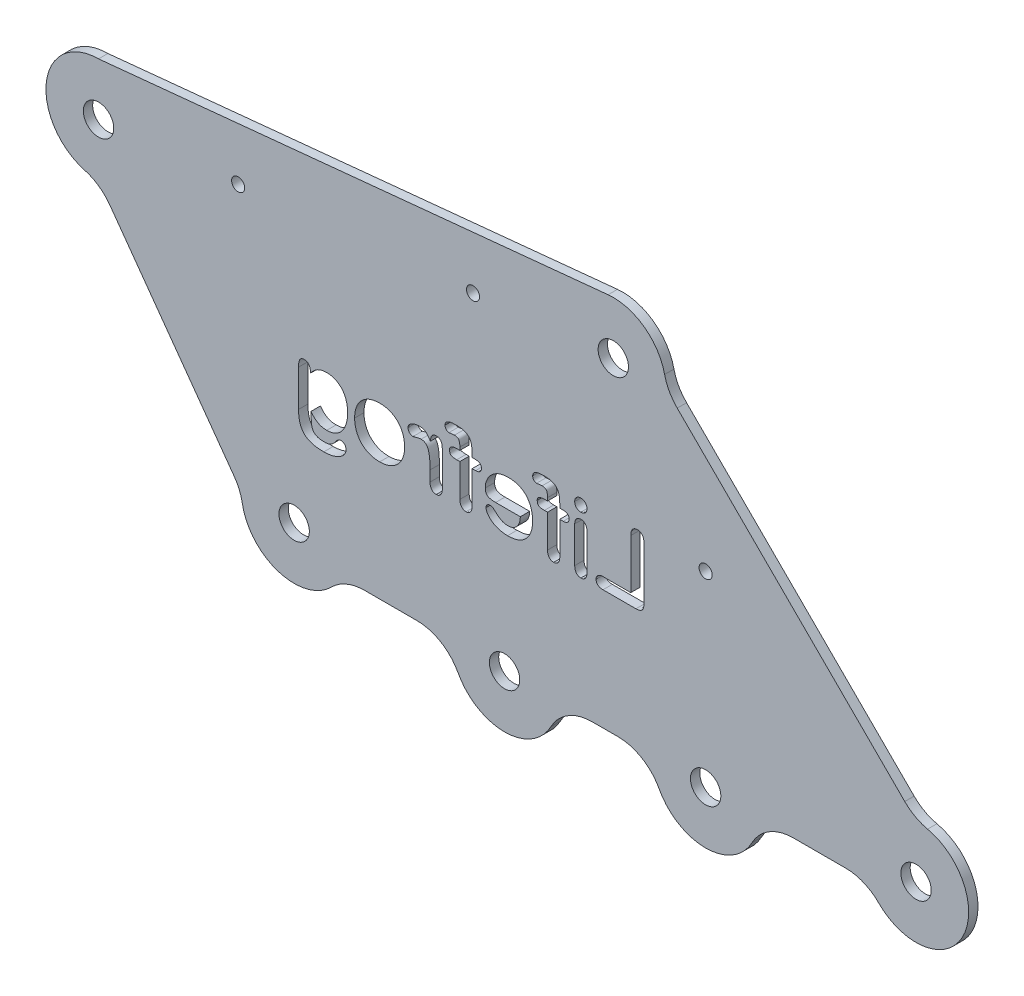
from build123d import *

# Parameters (mm, degrees)
SKETCH2_R           = 3.25
BOSS_EXTRUDE1_DEPTH = 2
SKETCH7_R           = 1.4
CUT_EXTRUDE4_DEPTH  = 171.622034838
CUT_EXTRUDE5_DEPTH  = 171.622034838
SKETCH9_R           = 4.424451358
SKETCH9_R_2         = 3.80051452
CUT_EXTRUDE6_DEPTH  = 10


with BuildPart() as part:
    # Sketch2 → Boss-Extrude1 (new body)
    with BuildSketch(Plane.XY):
        with BuildLine():
            Line((-146.482261324, -3.415116213), (-119.900209046, -40.345357838))
            ThreePointArc((-119.900209046, -40.345357838), (-118.800607084, -42.305283789), (-118.166440512, -44.46126778))
            ThreePointArc((-118.166440512, -44.46126778), (-110.464641635, -53.249940436), (-99.116582089, -50.460672154))
            ThreePointArc((-99.116582089, -50.460672154), (-95.868116105, -48.284014232), (-92.03329116, -47.519495684))
            Line((-92.03329116, -47.519495684), (-80.835284384, -47.519495684))
            ThreePointArc((-80.835284384, -47.519495684), (-75.69032683, -48.944566427), (-72.011754972, -52.813613331))
            ThreePointArc((-72.011754972, -52.813613331), (-62.085284384, -58.769495684), (-52.158813796, -52.813613331))
            ThreePointArc((-52.158813796, -52.813613331), (-48.480241938, -48.944566427), (-43.335284384, -47.519495684))
            Line((-43.335284384, -47.519495684), (-37.835284384, -47.519495684))
            ThreePointArc((-37.835284384, -47.519495684), (-32.69032683, -48.944566427), (-29.011754972, -52.813613331))
            ThreePointArc((-29.011754972, -52.813613331), (-19.085284384, -58.769495684), (-9.158813796, -52.813613331))
            ThreePointArc((-9.158813796, -52.813613331), (-5.480241938, -48.944566427), (-0.335284384, -47.519495684))
            Line((-0.335284384, -47.519495684), (10.862722393, -47.519495684))
            ThreePointArc((10.862722393, -47.519495684), (14.697547337, -48.284014232), (17.946013321, -50.460672154))
            ThreePointArc((17.946013321, -50.460672154), (35.766499874, -47.951332108), (28.376808321, -31.542219177))
            ThreePointArc((28.376808321, -31.542219177), (25.750662206, -30.549280626), (23.504036076, -28.865463113))
            Line((23.504036076, -28.865463113), (-25.162062888, 19.666448763))
            ThreePointArc((-25.162062888, 19.666448763), (-26.856748601, 21.916875345), (-27.856526133, 24.55066052))
            ThreePointArc((-27.856526133, 24.55066052), (-32.247109026, 31.201144138), (-39.941717654, 33.27458296))
            Line((-39.941717654, 33.27458296), (-148.918739614, 22.469864413))
            ThreePointArc((-148.918739614, 22.469864413), (-160.065949313, 12.737169894), (-151.925623591, 0.379147243))
            ThreePointArc((-151.925623591, 0.379147243), (-148.880072017, -1.053350399), (-146.482261324, -3.415116213))
        make_face()
        with Locations((25.914715616, -42.519495684)):
            Circle(SKETCH2_R, mode=Mode.SUBTRACT)
        with Locations((-19.085284384, -47.519495684)):
            Circle(SKETCH2_R, mode=Mode.SUBTRACT)
        with Locations((-62.085284384, -47.519495684)):
            Circle(SKETCH2_R, mode=Mode.SUBTRACT)
        with Locations((-107.085284384, -42.519495684)):
            Circle(SKETCH2_R, mode=Mode.SUBTRACT)
        with Locations((-148.918739614, 11.219864413)):
            Circle(SKETCH2_R, mode=Mode.SUBTRACT)
        with Locations((-38.831758764, 22.07947281)):
            Circle(SKETCH2_R, mode=Mode.SUBTRACT)
    extrude(amount=BOSS_EXTRUDE1_DEPTH)

    # Sketch7 → Cut-Extrude4 (cut, through all)
    with BuildSketch(Plane.XY.offset(2)):
        with Locations((-119.063647537, 14.164941171)):
            Circle(SKETCH7_R)
        with Locations((-68.831758764, 19.120101507)):
            Circle(SKETCH7_R)
        with Locations((-19.085284384, -7.519495684)):
            Circle(SKETCH7_R)
    extrude(amount=-CUT_EXTRUDE4_DEPTH, mode=Mode.SUBTRACT)

    # Sketch8 → Cut-Extrude5 (cut, through all)
    # profile 1 of 9: a face of its own
    with BuildSketch(Plane(origin=(0, 0, 0), x_dir=(-1, 0, 0), z_dir=(0, 0, -1))):
        with BuildLine():
            Line((35.086320726, -8.88917677), (35.086320726, -19.477067395))
            Line((35.086320726, -19.477067395), (41.039445726, -19.477067395))
            add(Edge.make_bspline(
                [(41.039445726, -19.477067395), (41.151207657, -19.479993195), (41.364330782, -19.485572515), (41.662298188, -19.554542719), (41.923339942, -19.661257744), (42.134401002, -19.819951832), (42.304522289, -20.005566477), (42.428077526, -20.217869304), (42.500347045, -20.454899643), (42.50877144, -20.620129964), (42.513078539, -20.704606457)],
                knots=[0, 0, 0, 0, 1.240270116, 2.365118784, 3.381765818, 4.352609133, 5.275186246, 6.165500839, 7.062084633, 8, 8, 8, 8], degree=3))
            add(Edge.make_bspline(
                [(42.513078539, -20.704606457), (42.508946769, -20.791061883), (42.500954328, -20.958300126), (42.427991131, -21.197153566), (42.305901504, -21.407864411), (42.137936653, -21.589554136), (41.927138947, -21.739731647), (41.667288952, -21.839448431), (41.367976859, -21.905877279), (41.153144472, -21.911559901), (41.039445726, -21.914567395)],
                knots=[0, 0, 0, 0, 0.961785517, 1.860465312, 2.752861249, 3.654173772, 4.599371787, 5.609990076, 6.735101654, 8, 8, 8, 8], degree=3))
            Line((41.039445726, -21.914567395), (33.996476976, -21.914567395))
            add(Edge.make_bspline(
                [(33.996476976, -21.914567395), (33.853353838, -21.910822677), (33.586803908, -21.903848583), (33.219164265, -21.820051925), (32.910084712, -21.691568649), (32.663815683, -21.496286799), (32.482305295, -21.2361672), (32.358100514, -20.915092293), (32.287886266, -20.530846545), (32.278723904, -20.25471837), (32.273820726, -20.106950207)],
                knots=[0, 0, 0, 0, 1.184943227, 2.206816713, 3.109923682, 3.939837529, 4.776053014, 5.71019795, 6.774627611, 8, 8, 8, 8], degree=3))
            Line((32.273820726, -20.106950207), (32.273820726, -8.88917677))
            add(Edge.make_bspline(
                [(32.273820726, -8.88917677), (32.277444522, -8.749162056), (32.284268854, -8.485486372), (32.356957437, -8.118037422), (32.476634418, -7.804802622), (32.645141816, -7.546892469), (32.856855173, -7.348035389), (33.099081612, -7.202614303), (33.373976884, -7.118889739), (33.566226734, -7.107793002), (33.665422289, -7.102067395)],
                knots=[0, 0, 0, 0, 1.312227502, 2.471186598, 3.495416453, 4.440711492, 5.33513045, 6.197779038, 7.0701043, 8, 8, 8, 8], degree=3))
            add(Edge.make_bspline(
                [(33.665422289, -7.102067395), (33.766728298, -7.106162598), (33.963485083, -7.114116312), (34.241681246, -7.204196573), (34.491196095, -7.34317393), (34.705487503, -7.541754535), (34.882515406, -7.795771782), (35.002902616, -8.111096688), (35.076257378, -8.481501141), (35.082815622, -8.747181708), (35.086320726, -8.88917677)],
                knots=[0, 0, 0, 0, 0.937651975, 1.821110013, 2.686129292, 3.571911612, 4.510265029, 5.535848738, 6.683015045, 8, 8, 8, 8], degree=3))
        make_face()
    # profile 2 of 9: a face of its own
    with BuildSketch(Plane(origin=(0, 0, 0), x_dir=(-1, 0, 0), z_dir=(0, 0, -1))):
        with BuildLine():
            Line((47.086320726, -12.74464552), (47.086320726, -20.476090832))
            add(Edge.make_bspline(
                [(47.086320726, -20.476090832), (47.082420593, -20.602435528), (47.075064066, -20.84074997), (47.005182236, -21.174236118), (46.88809835, -21.460321774), (46.722706311, -21.694972614), (46.519526295, -21.876468441), (46.28964053, -22.009165841), (46.031653529, -22.087195916), (45.85149376, -22.097028675), (45.759172289, -22.102067395)],
                knots=[0, 0, 0, 0, 1.279660949, 2.41372764, 3.434282009, 4.393028164, 5.297478756, 6.175532382, 7.06506577, 8, 8, 8, 8], degree=3))
            add(Edge.make_bspline(
                [(45.759172289, -22.102067395), (45.666704772, -22.097531408), (45.487838174, -22.08875712), (45.23365211, -22.004912745), (45.006451484, -21.871389965), (44.811013414, -21.682373157), (44.650959039, -21.445866625), (44.541087672, -21.160395096), (44.473171135, -20.832780478), (44.465421067, -20.599508451), (44.461320726, -20.476090832)],
                knots=[0, 0, 0, 0, 0.944656094, 1.82731652, 2.710883517, 3.62364324, 4.589202842, 5.612771424, 6.736985008, 8, 8, 8, 8], degree=3))
            Line((44.461320726, -20.476090832), (44.461320726, -12.823747082))
            add(Edge.make_bspline(
                [(44.461320726, -12.823747082), (44.4655151, -12.699382119), (44.473445887, -12.464230884), (44.539697696, -12.136087305), (44.650415089, -11.854229206), (44.811202223, -11.625466775), (45.007817757, -11.44586487), (45.234070933, -11.317596829), (45.488859368, -11.241954113), (45.666855774, -11.232151465), (45.759172289, -11.227067395)],
                knots=[0, 0, 0, 0, 1.282601348, 2.425162879, 3.437763456, 4.38569495, 5.284727511, 6.164859808, 7.048218153, 8, 8, 8, 8], degree=3))
            add(Edge.make_bspline(
                [(45.759172289, -11.227067395), (45.851434596, -11.232364163), (46.031201162, -11.242684541), (46.289294531, -11.316791228), (46.519597684, -11.446472242), (46.719799732, -11.624386887), (46.886864263, -11.846010703), (47.003355814, -12.112795725), (47.074726656, -12.416719887), (47.082335115, -12.631916842), (47.086320726, -12.74464552)],
                knots=[0, 0, 0, 0, 0.975882645, 1.901438153, 2.812865763, 3.75006033, 4.717368935, 5.725761173, 6.808663735, 8, 8, 8, 8], degree=3))
        make_face()
    # profile 3 of 9: a face of its own
    with BuildSketch(Plane(origin=(0, 0, 0), x_dir=(-1, 0, 0), z_dir=(0, 0, -1))):
        with BuildLine():
            add(Edge.make_bspline(
                [(45.788469164, -9.914567395), (45.700155278, -9.911112501), (45.527837589, -9.904371326), (45.279123369, -9.837014704), (45.05142568, -9.726888524), (44.844494731, -9.578448802), (44.672494362, -9.386651845), (44.546452039, -9.154497095), (44.472722475, -8.885778489), (44.46522284, -8.695310105), (44.461320726, -8.59620802)],
                knots=[0, 0, 0, 0, 1.006201835, 1.963296869, 2.915511555, 3.880878732, 4.85189213, 5.829536295, 6.870691953, 8, 8, 8, 8], degree=3))
            add(Edge.make_bspline(
                [(44.461320726, -8.59620802), (44.466503012, -8.504891338), (44.476546269, -8.327919822), (44.551669892, -8.073896193), (44.680826892, -7.848246813), (44.854448523, -7.652100465), (45.060826482, -7.494003153), (45.286053439, -7.371969471), (45.53257688, -7.303278473), (45.702130039, -7.29419357), (45.788469164, -7.289567395)],
                knots=[0, 0, 0, 0, 1.057408726, 2.04925565, 3.037480321, 4.047814229, 5.064214746, 6.036169889, 6.999986943, 8, 8, 8, 8], degree=3))
            add(Edge.make_bspline(
                [(45.788469164, -7.289567395), (45.871883282, -7.293289281), (46.035245133, -7.300578386), (46.272968232, -7.365176401), (46.494233713, -7.471719022), (46.696092474, -7.61868617), (46.874547315, -7.801949122), (46.996351464, -8.035133325), (47.076989401, -8.302838261), (47.083100242, -8.494958443), (47.086320726, -8.59620802)],
                knots=[0, 0, 0, 0, 0.967133894, 1.894077239, 2.837452275, 3.803721558, 4.782485793, 5.777084342, 6.828497526, 8, 8, 8, 8], degree=3))
            add(Edge.make_bspline(
                [(47.086320726, -8.59620802), (47.082548229, -8.694407685), (47.075299369, -8.883098506), (46.999769728, -9.148438196), (46.878868744, -9.381879948), (46.705206821, -9.571319036), (46.504492812, -9.722899361), (46.282136483, -9.833786351), (46.041845864, -9.904963009), (45.873933033, -9.911327839), (45.788469164, -9.914567395)],
                knots=[0, 0, 0, 0, 1.133982342, 2.178948973, 3.165031597, 4.149752721, 5.126395816, 6.06160272, 7.013399203, 8, 8, 8, 8], degree=3))
        make_face()
    # profile 4 of 9: a face of its own
    with BuildSketch(Plane(origin=(0, 0, 0), x_dir=(-1, 0, 0), z_dir=(0, 0, -1))):
        with BuildLine():
            Line((49.632219164, -11.414567395), (50.273820726, -11.414567395))
            Line((50.273820726, -11.414567395), (50.273820726, -10.591325207))
            add(Edge.make_bspline(
                [(50.273820726, -10.591325207), (50.277514056, -10.388045332), (50.284509589, -10.00301306), (50.342549558, -9.457909943), (50.436641901, -8.978381027), (50.569332837, -8.557808501), (50.755633772, -8.195572563), (50.996610195, -7.887535194), (51.293777818, -7.633608774), (51.648730133, -7.431434885), (52.067068931, -7.280410479), (52.552532894, -7.174729198), (53.108091552, -7.111487828), (53.502156344, -7.105323868), (53.710344164, -7.102067395)],
                knots=[0, 0, 0, 0, 1.272338929, 2.409936283, 3.426662608, 4.327577154, 5.161578725, 5.96266415, 6.760383261, 7.592994418, 8.506024445, 9.533847079, 10.697110196, 12, 12, 12, 12], degree=3))
            add(Edge.make_bspline(
                [(53.710344164, -7.102067395), (53.895146779, -7.104261268), (54.241413904, -7.108371958), (54.723647309, -7.168286024), (55.135762658, -7.255167266), (55.473032061, -7.391161667), (55.744889456, -7.558653085), (55.937764712, -7.776533401), (56.05427242, -8.037027657), (56.067659952, -8.223910447), (56.074601976, -8.320817395)],
                knots=[0, 0, 0, 0, 1.495564663, 2.802259462, 3.930374803, 4.895312065, 5.735498063, 6.492167842, 7.218122695, 8, 8, 8, 8], degree=3))
            add(Edge.make_bspline(
                [(56.074601976, -8.320817395), (56.07205453, -8.384563693), (56.067042815, -8.509974928), (56.019565864, -8.690669099), (55.937272087, -8.855101057), (55.831089458, -9.002344218), (55.703605103, -9.125761707), (55.560931421, -9.215318606), (55.405925119, -9.272564588), (55.297752865, -9.278650351), (55.242570726, -9.281754895)],
                knots=[0, 0, 0, 0, 1.08569999, 2.135951137, 3.156332465, 4.20565892, 5.218674748, 6.161348951, 7.062045096, 8, 8, 8, 8], degree=3))
            add(Edge.make_bspline(
                [(55.242570726, -9.281754895), (55.211291096, -9.281243662), (55.139763808, -9.280074624), (55.017892004, -9.265550853), (54.867145158, -9.249871502), (54.639618335, -9.213428957), (54.363834674, -9.175272517), (54.14601204, -9.167906783), (54.047258226, -9.164567395)],
                knots=[0, 0, 0, 0, 0.468218035, 1.070676523, 1.83620524, 2.737967929, 4.521099009, 6, 6, 6, 6], degree=3))
            add(Edge.make_bspline(
                [(54.047258226, -9.164567395), (53.935335203, -9.168513751), (53.730509601, -9.175735811), (53.453388449, -9.253609551), (53.236438618, -9.387787922), (53.093840565, -9.587280743), (53.00705741, -9.82836939), (52.94477266, -10.108223991), (52.902635068, -10.432859402), (52.900145328, -10.66441903), (52.898820726, -10.78761427)],
                knots=[0, 0, 0, 0, 1.158634456, 2.120368021, 2.955008234, 3.751380872, 4.611223429, 5.599229928, 6.722733105, 8, 8, 8, 8], degree=3))
            Line((52.898820726, -10.78761427), (52.898820726, -11.414567395))
            Line((52.898820726, -11.414567395), (53.563859789, -11.414567395))
            add(Edge.make_bspline(
                [(53.563859789, -11.414567395), (53.684179087, -11.416649074), (53.910242779, -11.420560268), (54.225792592, -11.467875581), (54.49621768, -11.540251074), (54.718209635, -11.648680399), (54.893566863, -11.789413733), (55.016660753, -11.965226471), (55.094330745, -12.172143548), (55.10125483, -12.32106946), (55.104875414, -12.398942395)],
                knots=[0, 0, 0, 0, 1.396050608, 2.622990337, 3.6962846, 4.634546857, 5.472373731, 6.277878481, 7.09950757, 8, 8, 8, 8], degree=3))
            add(Edge.make_bspline(
                [(55.104875414, -12.398942395), (55.100784732, -12.506003658), (55.0933337, -12.701011923), (55.017531846, -12.965095468), (54.888175636, -13.171513058), (54.692271136, -13.302589493), (54.461307669, -13.37783369), (54.196374468, -13.437731598), (53.892808985, -13.470942071), (53.677213775, -13.474956644), (53.563859789, -13.477067395)],
                knots=[0, 0, 0, 0, 1.171181197, 2.133264703, 2.982673099, 3.781862637, 4.659228062, 5.636037739, 6.757094158, 8, 8, 8, 8], degree=3))
            Line((53.563859789, -13.477067395), (52.898820726, -13.477067395))
            Line((52.898820726, -13.477067395), (52.898820726, -20.49073927))
            add(Edge.make_bspline(
                [(52.898820726, -20.49073927), (52.894890647, -20.614179922), (52.887425469, -20.848655192), (52.816934516, -21.176561155), (52.703366177, -21.461585314), (52.538062875, -21.695052259), (52.335369862, -21.875428653), (52.106713482, -22.010618694), (51.846897908, -22.086940159), (51.664920121, -22.096942211), (51.571672289, -22.102067395)],
                knots=[0, 0, 0, 0, 1.256538349, 2.386792053, 3.399650087, 4.363398215, 5.272567509, 6.146574889, 7.050280375, 8, 8, 8, 8], degree=3))
            add(Edge.make_bspline(
                [(51.571672289, -22.102067395), (51.482224977, -22.09710813), (51.307699782, -22.087431855), (51.057160741, -22.007724342), (50.831657988, -21.876461922), (50.631448396, -21.694722042), (50.469647741, -21.460721404), (50.355528177, -21.176665365), (50.285268804, -20.8486244), (50.277769023, -20.614169302), (50.273820726, -20.49073927)],
                knots=[0, 0, 0, 0, 0.920542794, 1.796117823, 2.680158831, 3.592296685, 4.561321835, 5.585807508, 6.729036556, 8, 8, 8, 8], degree=3))
            Line((50.273820726, -20.49073927), (50.273820726, -13.477067395))
            Line((50.273820726, -13.477067395), (49.532609789, -13.477067395))
            add(Edge.make_bspline(
                [(49.532609789, -13.477067395), (49.437497333, -13.474545828), (49.257144996, -13.469764431), (49.004612129, -13.411306638), (48.782055088, -13.326305771), (48.598641031, -13.197615767), (48.451306666, -13.041843238), (48.352045043, -12.858126156), (48.285842232, -12.656347119), (48.279207657, -12.513757181), (48.275773851, -12.43995802)],
                knots=[0, 0, 0, 0, 1.239726906, 2.350771435, 3.369360947, 4.331849643, 5.252604265, 6.143447782, 7.039118766, 8, 8, 8, 8], degree=3))
            add(Edge.make_bspline(
                [(48.275773851, -12.43995802), (48.278931014, -12.359364997), (48.28493967, -12.205981751), (48.351465421, -11.99217143), (48.459813646, -11.809230275), (48.613188222, -11.659732473), (48.810357544, -11.547566221), (49.047458479, -11.470404208), (49.325403123, -11.419710271), (49.525517403, -11.416355939), (49.632219164, -11.414567395)],
                knots=[0, 0, 0, 0, 0.995382564, 1.894394861, 2.740686784, 3.604514537, 4.515167111, 5.524921804, 6.68027808, 8, 8, 8, 8], degree=3))
        make_face()
    # profile 5 of 9: a face of its own
    with BuildSketch(Plane(origin=(0, 0, 0), x_dir=(-1, 0, 0), z_dir=(0, 0, -1))):
        with BuildLine():
            Line((63.993547289, -17.227067395), (58.711320726, -17.227067395))
            add(Edge.make_bspline(
                [(58.711320726, -17.227067395), (58.716485938, -17.373895282), (58.726607174, -17.661604604), (58.802714884, -18.07799563), (58.915860462, -18.469071713), (59.073647335, -18.829619398), (59.270554735, -19.153364248), (59.492765404, -19.442705533), (59.750507136, -19.684973297), (60.03645821, -19.88267243), (60.345770403, -20.033615445), (60.670482904, -20.148105778), (61.01253608, -20.212156224), (61.245255038, -20.222066531), (61.362687914, -20.227067395)],
                knots=[0, 0, 0, 0, 1.179639705, 2.311504614, 3.392005435, 4.44652888, 5.46432702, 6.431680492, 7.370191764, 8.295643874, 9.215452015, 10.129041871, 11.055891293, 12, 12, 12, 12], degree=3))
            add(Edge.make_bspline(
                [(61.362687914, -20.227067395), (61.517315025, -20.221290078), (61.81522082, -20.210159454), (62.248320892, -20.128402077), (62.65037596, -19.976572402), (63.029981243, -19.770423211), (63.382588562, -19.521193305), (63.667016112, -19.296133613), (63.89432751, -19.094787244), (64.085795058, -18.918875484), (64.304668367, -18.722900775), (64.455732274, -18.581855292), (64.535539476, -18.507340832)],
                knots=[0, 0, 0, 0, 1.247905556, 2.404224554, 3.538983975, 4.702801183, 5.881313568, 7.020008393, 7.628790321, 8.331868978, 9.11872483, 10, 10, 10, 10], degree=3))
            add(Edge.make_bspline(
                [(64.535539476, -18.507340832), (64.572653698, -18.48027204), (64.649909263, -18.423926662), (64.791469612, -18.369543996), (64.954050743, -18.338198915), (65.069560502, -18.333846809), (65.130266039, -18.331559582)],
                knots=[0, 0, 0, 0, 0.868866131, 1.808598965, 2.848320883, 4, 4, 4, 4], degree=3))
            add(Edge.make_bspline(
                [(65.130266039, -18.331559582), (65.197009882, -18.333900139), (65.324294385, -18.33836372), (65.504066974, -18.385198991), (65.666679189, -18.453914722), (65.804779268, -18.559309462), (65.921073021, -18.686697731), (66.001439392, -18.843467551), (66.053282091, -19.021621344), (66.057023071, -19.149522649), (66.058976976, -19.216325207)],
                knots=[0, 0, 0, 0, 1.102465736, 2.102468148, 3.057950005, 4.00546365, 4.956145095, 5.889200524, 6.897534264, 8, 8, 8, 8], degree=3))
            add(Edge.make_bspline(
                [(66.058976976, -19.216325207), (66.055140543, -19.281058441), (66.047007822, -19.418284177), (65.990684139, -19.630580971), (65.89753, -19.856403047), (65.771680317, -20.095129398), (65.612344825, -20.341196211), (65.409653802, -20.580823639), (65.174931597, -20.819411181), (64.902221637, -21.049528185), (64.595344086, -21.269822809), (64.249335099, -21.470546591), (63.864239991, -21.646257285), (63.446257949, -21.809324299), (62.992864569, -21.941257019), (62.504327356, -22.0333954), (61.984342492, -22.094193404), (61.625563625, -22.099400308), (61.441789476, -22.102067395)],
                knots=[0, 0, 0, 0, 0.525537938, 1.114069654, 1.772306998, 2.506549159, 3.302753817, 4.147512317, 5.050313588, 6.017967943, 7.041213872, 8.114344659, 9.260276936, 10.47524946, 11.755151616, 13.087980653, 14.508401902, 16, 16, 16, 16], degree=3))
            add(Edge.make_bspline(
                [(61.441789476, -22.102067395), (61.231648736, -22.097519737), (60.821964685, -22.088653761), (60.226784289, -22.021353682), (59.669210967, -21.908362258), (59.150569744, -21.745772772), (58.667513306, -21.542562166), (58.224053508, -21.288395048), (57.820679107, -20.987522623), (57.455460166, -20.64373407), (57.134442572, -20.257975864), (56.850340149, -19.841633038), (56.616330833, -19.388813691), (56.421842234, -18.905299727), (56.270116103, -18.389217889), (56.162139879, -17.840151988), (56.09676424, -17.258936562), (56.089857706, -16.86005426), (56.086320726, -16.655778332)],
                knots=[0, 0, 0, 0, 1.161895415, 2.265196273, 3.307380836, 4.303185105, 5.266158709, 6.199917451, 7.122316156, 8.043005893, 8.966794753, 9.89246016, 10.824859252, 11.779559524, 12.770652002, 13.794812853, 14.87067777, 16, 16, 16, 16], degree=3))
            add(Edge.make_bspline(
                [(56.086320726, -16.655778332), (56.089863596, -16.462226663), (56.096844531, -16.080848933), (56.163955879, -15.519624607), (56.268451373, -14.979723953), (56.413728423, -14.462108781), (56.604168314, -13.975533109), (56.829293377, -13.519340339), (57.098097208, -13.102077052), (57.402287332, -12.718106315), (57.750981266, -12.376213514), (58.140980683, -12.074737303), (58.573216423, -11.817183613), (59.045085371, -11.603132446), (59.551427203, -11.433045112), (60.089833345, -11.315293392), (60.656383848, -11.238702527), (61.044069017, -11.231007425), (61.242570726, -11.227067395)],
                knots=[0, 0, 0, 0, 1.095507523, 2.15860795, 3.195309999, 4.206995944, 5.197887526, 6.149926361, 7.082497361, 8.003040645, 8.917987058, 9.840388418, 10.787726911, 11.760164811, 12.769081724, 13.806049167, 14.876658106, 16, 16, 16, 16], degree=3))
            add(Edge.make_bspline(
                [(61.242570726, -11.227067395), (61.372538981, -11.22810589), (61.627045231, -11.23013949), (62.001408011, -11.265268194), (62.362503375, -11.313850777), (62.710727077, -11.382379075), (63.04253843, -11.478141357), (63.361054388, -11.589179566), (63.666118712, -11.720379466), (63.955121946, -11.874248291), (64.230989577, -12.038773815), (64.485024674, -12.223475089), (64.726773861, -12.411434191), (64.947774364, -12.616494045), (65.15303199, -12.831425773), (65.33677691, -13.06140635), (65.506460871, -13.299708893), (65.701149201, -13.632045496), (65.90499798, -14.058699678), (66.086744263, -14.582630241), (66.196585792, -15.115069491), (66.210329972, -15.472667779), (66.217180101, -15.65089552)],
                knots=[0, 0, 0, 0, 1.048847282, 2.053872234, 3.03283051, 3.989924751, 4.915857681, 5.818505585, 6.711913066, 7.593554535, 8.460263899, 9.302531452, 10.127499996, 10.930978608, 11.734070318, 12.524563272, 13.305443929, 14.093732096, 15.631266151, 17.114748765, 18.561984696, 20, 20, 20, 20], degree=3))
            add(Edge.make_bspline(
                [(66.217180101, -15.65089552), (66.215610952, -15.730068621), (66.212617901, -15.881086234), (66.186937014, -16.097314554), (66.140772023, -16.291180146), (66.075053252, -16.464024902), (65.995488051, -16.617172785), (65.89278487, -16.74579461), (65.773975455, -16.854326494), (65.582181996, -16.968584464), (65.300769745, -17.07492862), (64.916543956, -17.164445981), (64.474589043, -17.219117531), (64.159728488, -17.224321026), (63.993547289, -17.227067395)],
                knots=[0, 0, 0, 0, 0.899856074, 1.716417764, 2.470354694, 3.159019517, 3.814679391, 4.423252287, 5.02068589, 5.633798556, 6.949059873, 8.421953477, 10.111532063, 12, 12, 12, 12], degree=3))
        make_face()
        with BuildLine():
            Line((58.711320726, -15.727067395), (63.606828539, -15.727067395))
            add(Edge.make_bspline(
                [(63.606828539, -15.727067395), (63.597892017, -15.620388862), (63.580506578, -15.412852503), (63.525243597, -15.113999216), (63.460289426, -14.835108466), (63.374142884, -14.577543089), (63.272543011, -14.341165405), (63.154505162, -14.123236857), (63.017386306, -13.928050969), (62.863841728, -13.753386376), (62.694974951, -13.600302554), (62.514511391, -13.465060191), (62.318539721, -13.352382039), (62.109343802, -13.262997606), (61.88971522, -13.187447347), (61.65522259, -13.140138129), (61.409640164, -13.105158478), (61.240753138, -13.103110926), (61.154680101, -13.102067395)],
                knots=[0, 0, 0, 0, 1.274652096, 2.479755284, 3.617009281, 4.684005428, 5.71065458, 6.679155714, 7.63137599, 8.546404667, 9.444107911, 10.342338794, 11.228430864, 12.129821099, 13.049645363, 13.989847955, 14.975528821, 16, 16, 16, 16], degree=3))
            add(Edge.make_bspline(
                [(61.154680101, -13.102067395), (61.072577515, -13.10475237), (60.911762666, -13.110011447), (60.674960792, -13.138599654), (60.450175128, -13.191199261), (60.236485897, -13.265652746), (60.033877273, -13.359118289), (59.842432731, -13.474146939), (59.662756958, -13.609700616), (59.495375907, -13.766189336), (59.339368932, -13.941320054), (59.201880517, -14.138573533), (59.081832188, -14.355594311), (58.972348183, -14.589561112), (58.881951346, -14.845787112), (58.809840485, -15.122470817), (58.750931011, -15.417941176), (58.724734593, -15.622383021), (58.711320726, -15.727067395)],
                knots=[0, 0, 0, 0, 0.988988761, 1.937138454, 2.867098831, 3.763434994, 4.657917626, 5.549380048, 6.447873833, 7.363218941, 8.304708192, 9.267190604, 10.251834605, 11.288414524, 12.374576878, 13.518478699, 14.729337904, 16, 16, 16, 16], degree=3))
        make_face(mode=Mode.SUBTRACT)
    # profile 6 of 9: a face of its own
    with BuildSketch(Plane(origin=(0, 0, 0), x_dir=(-1, 0, 0), z_dir=(0, 0, -1))):
        with BuildLine():
            Line((68.382219164, -11.414567395), (69.023820726, -11.414567395))
            Line((69.023820726, -11.414567395), (69.023820726, -10.591325207))
            add(Edge.make_bspline(
                [(69.023820726, -10.591325207), (69.027514056, -10.388045332), (69.034509589, -10.00301306), (69.092549558, -9.457909943), (69.186641901, -8.978381027), (69.319332837, -8.557808501), (69.505633772, -8.195572563), (69.746610195, -7.887535194), (70.043777818, -7.633608774), (70.398730133, -7.431434885), (70.817068931, -7.280410479), (71.302532894, -7.174729198), (71.858091552, -7.111487828), (72.252156344, -7.105323868), (72.460344164, -7.102067395)],
                knots=[0, 0, 0, 0, 1.272338929, 2.409936283, 3.426662608, 4.327577154, 5.161578725, 5.96266415, 6.760383261, 7.592994418, 8.506024445, 9.533847079, 10.697110196, 12, 12, 12, 12], degree=3))
            add(Edge.make_bspline(
                [(72.460344164, -7.102067395), (72.645146779, -7.104261268), (72.991413904, -7.108371958), (73.473647309, -7.168286024), (73.885762658, -7.255167266), (74.223032061, -7.391161667), (74.494889456, -7.558653085), (74.687764712, -7.776533401), (74.80427242, -8.037027657), (74.817659952, -8.223910447), (74.824601976, -8.320817395)],
                knots=[0, 0, 0, 0, 1.495564663, 2.802259462, 3.930374803, 4.895312065, 5.735498063, 6.492167842, 7.218122695, 8, 8, 8, 8], degree=3))
            add(Edge.make_bspline(
                [(74.824601976, -8.320817395), (74.82205453, -8.384563693), (74.817042815, -8.509974928), (74.769565864, -8.690669099), (74.687272087, -8.855101057), (74.581089458, -9.002344218), (74.453605103, -9.125761707), (74.310931421, -9.215318606), (74.155925119, -9.272564588), (74.047752865, -9.278650351), (73.992570726, -9.281754895)],
                knots=[0, 0, 0, 0, 1.08569999, 2.135951137, 3.156332465, 4.20565892, 5.218674748, 6.161348951, 7.062045096, 8, 8, 8, 8], degree=3))
            add(Edge.make_bspline(
                [(73.992570726, -9.281754895), (73.961291096, -9.281243662), (73.889763808, -9.280074624), (73.767892004, -9.265550853), (73.617145158, -9.249871502), (73.389618335, -9.213428957), (73.113834674, -9.175272517), (72.89601204, -9.167906783), (72.797258226, -9.164567395)],
                knots=[0, 0, 0, 0, 0.468218035, 1.070676523, 1.83620524, 2.737967929, 4.521099009, 6, 6, 6, 6], degree=3))
            add(Edge.make_bspline(
                [(72.797258226, -9.164567395), (72.685335203, -9.168513751), (72.480509601, -9.175735811), (72.203388449, -9.253609551), (71.986438618, -9.387787922), (71.843840565, -9.587280743), (71.75705741, -9.82836939), (71.69477266, -10.108223991), (71.652635068, -10.432859402), (71.650145328, -10.66441903), (71.648820726, -10.78761427)],
                knots=[0, 0, 0, 0, 1.158634456, 2.120368021, 2.955008234, 3.751380872, 4.611223429, 5.599229928, 6.722733105, 8, 8, 8, 8], degree=3))
            Line((71.648820726, -10.78761427), (71.648820726, -11.414567395))
            Line((71.648820726, -11.414567395), (72.313859789, -11.414567395))
            add(Edge.make_bspline(
                [(72.313859789, -11.414567395), (72.434179087, -11.416649074), (72.660242779, -11.420560268), (72.975792592, -11.467875581), (73.24621768, -11.540251074), (73.468209635, -11.648680399), (73.643566863, -11.789413733), (73.766660753, -11.965226471), (73.844330745, -12.172143548), (73.85125483, -12.32106946), (73.854875414, -12.398942395)],
                knots=[0, 0, 0, 0, 1.396050608, 2.622990337, 3.6962846, 4.634546857, 5.472373731, 6.277878481, 7.09950757, 8, 8, 8, 8], degree=3))
            add(Edge.make_bspline(
                [(73.854875414, -12.398942395), (73.850784732, -12.506003658), (73.8433337, -12.701011923), (73.767531846, -12.965095468), (73.638175636, -13.171513058), (73.442271136, -13.302589493), (73.211307669, -13.37783369), (72.946374468, -13.437731598), (72.642808985, -13.470942071), (72.427213775, -13.474956644), (72.313859789, -13.477067395)],
                knots=[0, 0, 0, 0, 1.171181197, 2.133264703, 2.982673099, 3.781862637, 4.659228062, 5.636037739, 6.757094158, 8, 8, 8, 8], degree=3))
            Line((72.313859789, -13.477067395), (71.648820726, -13.477067395))
            Line((71.648820726, -13.477067395), (71.648820726, -20.49073927))
            add(Edge.make_bspline(
                [(71.648820726, -20.49073927), (71.644890647, -20.614179922), (71.637425469, -20.848655192), (71.566934516, -21.176561155), (71.453366177, -21.461585314), (71.288062875, -21.695052259), (71.085369862, -21.875428653), (70.856713482, -22.010618694), (70.596897908, -22.086940159), (70.414920121, -22.096942211), (70.321672289, -22.102067395)],
                knots=[0, 0, 0, 0, 1.256538349, 2.386792053, 3.399650087, 4.363398215, 5.272567509, 6.146574889, 7.050280375, 8, 8, 8, 8], degree=3))
            add(Edge.make_bspline(
                [(70.321672289, -22.102067395), (70.232224977, -22.09710813), (70.057699782, -22.087431855), (69.807160741, -22.007724342), (69.581657988, -21.876461922), (69.381448396, -21.694722042), (69.219647741, -21.460721404), (69.105528177, -21.176665365), (69.035268804, -20.8486244), (69.027769023, -20.614169302), (69.023820726, -20.49073927)],
                knots=[0, 0, 0, 0, 0.920542794, 1.796117823, 2.680158831, 3.592296685, 4.561321835, 5.585807508, 6.729036556, 8, 8, 8, 8], degree=3))
            Line((69.023820726, -20.49073927), (69.023820726, -13.477067395))
            Line((69.023820726, -13.477067395), (68.282609789, -13.477067395))
            add(Edge.make_bspline(
                [(68.282609789, -13.477067395), (68.187497333, -13.474545828), (68.007144996, -13.469764431), (67.754612129, -13.411306638), (67.532055088, -13.326305771), (67.348641031, -13.197615767), (67.201306666, -13.041843238), (67.102045043, -12.858126156), (67.035842232, -12.656347119), (67.029207657, -12.513757181), (67.025773851, -12.43995802)],
                knots=[0, 0, 0, 0, 1.239726906, 2.350771435, 3.369360947, 4.331849643, 5.252604265, 6.143447782, 7.039118766, 8, 8, 8, 8], degree=3))
            add(Edge.make_bspline(
                [(67.025773851, -12.43995802), (67.028931014, -12.359364997), (67.03493967, -12.205981751), (67.101465421, -11.99217143), (67.209813646, -11.809230275), (67.363188222, -11.659732473), (67.560357544, -11.547566221), (67.797458479, -11.470404208), (68.075403123, -11.419710271), (68.275517403, -11.416355939), (68.382219164, -11.414567395)],
                knots=[0, 0, 0, 0, 0.995382564, 1.894394861, 2.740686784, 3.604514537, 4.515167111, 5.524921804, 6.68027808, 8, 8, 8, 8], degree=3))
        make_face()
    # profile 7 of 9: a face of its own
    with BuildSketch(Plane(origin=(0, 0, 0), x_dir=(-1, 0, 0), z_dir=(0, 0, -1))):
        with BuildLine():
            Line((78.023820726, -18.21730177), (78.023820726, -20.464372082))
            add(Edge.make_bspline(
                [(78.023820726, -20.464372082), (78.019892411, -20.592663462), (78.012477123, -20.83483283), (77.942998305, -21.173173015), (77.826395379, -21.46268977), (77.660008013, -21.697626109), (77.457891862, -21.879946249), (77.226225762, -22.008518529), (76.969273636, -22.08740627), (76.789034454, -22.097099946), (76.696672289, -22.102067395)],
                knots=[0, 0, 0, 0, 1.292414504, 2.439627698, 3.46375878, 4.417332263, 5.316903122, 6.185375834, 7.070109971, 8, 8, 8, 8], degree=3))
            add(Edge.make_bspline(
                [(76.696672289, -22.102067395), (76.605316881, -22.09710505), (76.427986301, -22.087472609), (76.174585021, -22.009227395), (75.950610673, -21.875274697), (75.750230464, -21.695716107), (75.591715438, -21.458957778), (75.476710712, -21.174115576), (75.410996302, -20.840355995), (75.403041563, -20.602368539), (75.398820726, -20.476090832)],
                knots=[0, 0, 0, 0, 0.933294383, 1.81162385, 2.680186499, 3.585258456, 4.541104918, 5.566887721, 6.708974649, 8, 8, 8, 8], degree=3))
            Line((75.398820726, -20.476090832), (75.398820726, -13.028825207))
            add(Edge.make_bspline(
                [(75.398820726, -13.028825207), (75.402484719, -12.887967816), (75.409365917, -12.623429237), (75.466438734, -12.253599122), (75.562647251, -11.937580399), (75.705960969, -11.678454634), (75.886700953, -11.470839169), (76.115388002, -11.325648529), (76.384574397, -11.24325969), (76.575973652, -11.232631094), (76.676164476, -11.227067395)],
                knots=[0, 0, 0, 0, 1.34619872, 2.528241455, 3.567694465, 4.487339067, 5.340335725, 6.171799567, 7.043000931, 8, 8, 8, 8], degree=3))
            add(Edge.make_bspline(
                [(76.676164476, -11.227067395), (76.778250892, -11.23166171), (76.970074096, -11.240294554), (77.23647969, -11.31618665), (77.457457209, -11.448839438), (77.627712083, -11.63900255), (77.758010721, -11.876050227), (77.852605586, -12.159893812), (77.912208923, -12.492418163), (77.927694018, -12.729745798), (77.935930101, -12.855973645)],
                knots=[0, 0, 0, 0, 1.044883286, 1.963364657, 2.807970932, 3.650974255, 4.547373518, 5.563477854, 6.704082887, 8, 8, 8, 8], degree=3))
            add(Edge.make_bspline(
                [(77.935930101, -12.855973645), (78.015060213, -12.728702257), (78.166410553, -12.485273209), (78.414258837, -12.155879517), (78.661252631, -11.872664951), (78.918064986, -11.635812705), (79.199992654, -11.445181426), (79.525823034, -11.317799074), (79.892305657, -11.240889927), (80.150364302, -11.231818927), (80.285539476, -11.227067395)],
                knots=[0, 0, 0, 0, 1.18924255, 2.274636787, 3.268721947, 4.168850259, 5.041860026, 5.953170485, 6.927838526, 8, 8, 8, 8], degree=3))
            add(Edge.make_bspline(
                [(80.285539476, -11.227067395), (80.426467245, -11.232489358), (80.70936151, -11.243373249), (81.129162593, -11.320929872), (81.541294315, -11.453132582), (81.873448057, -11.600397905), (82.12154417, -11.742608322), (82.286513298, -11.857020394), (82.423463313, -11.98382965), (82.540429583, -12.115426572), (82.630091374, -12.257833616), (82.691453181, -12.409798496), (82.732078243, -12.569674136), (82.735800435, -12.679941298), (82.737687914, -12.735856457)],
                knots=[0, 0, 0, 0, 1.609451603, 3.230765888, 4.857137694, 6.544750347, 7.369389467, 8.121503283, 8.832102741, 9.496362917, 10.127778221, 10.743023735, 11.362602371, 12, 12, 12, 12], degree=3))
            add(Edge.make_bspline(
                [(82.737687914, -12.735856457), (82.734447601, -12.813574254), (82.728170407, -12.9641306), (82.658798765, -13.177988977), (82.553564502, -13.372817877), (82.402963372, -13.536083886), (82.232143043, -13.670264449), (82.04869511, -13.768279515), (81.85786951, -13.830801857), (81.727395914, -13.839133704), (81.662492601, -13.843278332)],
                knots=[0, 0, 0, 0, 1.088483127, 2.10862957, 3.128406662, 4.178128692, 5.204900727, 6.16884502, 7.089102868, 8, 8, 8, 8], degree=3))
            add(Edge.make_bspline(
                [(81.662492601, -13.843278332), (81.629178627, -13.840040056), (81.542984296, -13.831661558), (81.39025665, -13.792022204), (81.183740219, -13.737267753), (80.939095726, -13.659990651), (80.677274642, -13.576472525), (80.415801332, -13.523477689), (80.172440405, -13.484406004), (80.015169718, -13.479444147), (79.939836351, -13.477067395)],
                knots=[0, 0, 0, 0, 0.454029574, 1.174725489, 2.136679894, 3.357464208, 4.658256254, 5.865202561, 6.977422421, 8, 8, 8, 8], degree=3))
            add(Edge.make_bspline(
                [(79.939836351, -13.477067395), (79.845889074, -13.48141761), (79.66407233, -13.489836608), (79.402436427, -13.542788927), (79.170931902, -13.646030446), (78.963806071, -13.78176069), (78.785197235, -13.961357491), (78.627437355, -14.175620461), (78.492532222, -14.42885195), (78.379665037, -14.716376161), (78.288170049, -15.037011302), (78.209419115, -15.386257938), (78.144574547, -15.764579045), (78.099652318, -16.17561647), (78.064172897, -16.623081436), (78.042345893, -17.113612554), (78.02739976, -17.649826852), (78.025046467, -18.022954037), (78.023820726, -18.21730177)],
                knots=[0, 0, 0, 0, 0.794050632, 1.536731085, 2.238662641, 2.922771156, 3.616952249, 4.366019506, 5.163320251, 6.033432924, 6.970572952, 7.977209821, 9.05675488, 10.211001348, 11.468820729, 12.84806026, 14.358274693, 16, 16, 16, 16], degree=3))
        make_face()
    # profile 8 of 9: a face of its own
    with BuildSketch(Plane(origin=(0, 0, 0), x_dir=(-1, 0, 0), z_dir=(0, 0, -1))):
        with BuildLine():
            add(Edge.make_bspline(
                [(94.148820726, -16.67042677), (94.144486428, -16.865958198), (94.135962174, -17.250509443), (94.063694953, -17.815248603), (93.947256433, -18.356735194), (93.783210596, -18.872727585), (93.575555832, -19.359535852), (93.326640268, -19.813005753), (93.033540056, -20.230278447), (92.700172687, -20.609939276), (92.32896808, -20.9531364), (91.919659255, -21.251299839), (91.478131715, -21.51184656), (91.000994931, -21.724708392), (90.492501837, -21.896725611), (89.950942693, -22.014013606), (89.380489134, -22.090278252), (88.989896722, -22.098082029), (88.790422289, -22.102067395)],
                knots=[0, 0, 0, 0, 1.091425222, 2.14650367, 3.173246554, 4.180341516, 5.164818684, 6.123963105, 7.063390915, 8.006199165, 8.940071845, 9.880179878, 10.828459563, 11.797350195, 12.792281962, 13.820196984, 14.886780802, 16, 16, 16, 16], degree=3))
            add(Edge.make_bspline(
                [(88.790422289, -22.102067395), (88.591870928, -22.098480665), (88.203960118, -22.091473252), (87.638922615, -22.010038917), (87.101578123, -21.894122427), (86.597818959, -21.719498742), (86.124926323, -21.501305834), (85.684600318, -21.240748892), (85.277774178, -20.936460383), (84.904876516, -20.593622978), (84.569894039, -20.211571465), (84.277056806, -19.794745386), (84.02509942, -19.345794671), (83.821438064, -18.863747925), (83.658781072, -18.352053245), (83.547410974, -17.811904116), (83.473790099, -17.246665517), (83.465530656, -16.861096277), (83.461320726, -16.664567395)],
                knots=[0, 0, 0, 0, 1.111227023, 2.171009928, 3.19145726, 4.186070048, 5.150303806, 6.104321695, 7.046220171, 7.990735544, 8.936485474, 9.886464991, 10.839039205, 11.814379169, 12.812535149, 13.84133354, 14.899703965, 16, 16, 16, 16], degree=3))
            add(Edge.make_bspline(
                [(83.461320726, -16.664567395), (83.465514225, -16.466082785), (83.473742721, -16.076615619), (83.547624747, -15.505610155), (83.658102464, -14.959085186), (83.824393346, -14.441866346), (84.031384338, -13.954809255), (84.28098393, -13.502415749), (84.569020413, -13.085777538), (84.899270526, -12.708353762), (85.269523718, -12.371342104), (85.67658854, -12.072840001), (86.121373859, -11.818014706), (86.60023799, -11.604092229), (87.110125782, -11.43336561), (87.648459537, -11.31556227), (88.211067148, -11.238923762), (88.594851206, -11.231069711), (88.790422289, -11.227067395)],
                knots=[0, 0, 0, 0, 1.109458584, 2.176983352, 3.214831729, 4.223461232, 5.209438476, 6.170044374, 7.10777617, 8.036608407, 8.968213882, 9.902121437, 10.853822319, 11.829170779, 12.830797886, 13.854949514, 14.906911741, 16, 16, 16, 16], degree=3))
            add(Edge.make_bspline(
                [(88.790422289, -11.227067395), (88.988898872, -11.231174927), (89.378472694, -11.239237275), (89.948439143, -11.31420497), (90.490442677, -11.436140384), (91.001366108, -11.60975716), (91.480472692, -11.827861391), (91.928322675, -12.083355331), (92.33525077, -12.389972109), (92.707032955, -12.732556775), (93.044393285, -13.110969179), (93.333369182, -13.530134072), (93.585085083, -13.980402785), (93.789040515, -14.465390299), (93.949727682, -14.979606196), (94.06772993, -15.519473979), (94.135154052, -16.08667861), (94.144198204, -16.472983807), (94.148820726, -16.67042677)],
                knots=[0, 0, 0, 0, 1.106546112, 2.171950929, 3.199928065, 4.200661522, 5.175688508, 6.132331741, 7.070262582, 8.010799296, 8.948477062, 9.891329305, 10.844648531, 11.82089183, 12.82003801, 13.845645933, 14.898896381, 16, 16, 16, 16], degree=3))
        make_face()
        with BuildLine():
            add(Edge.make_bspline(
                [(91.523820726, -16.67042677), (91.52166415, -16.540471396), (91.517472317, -16.287871443), (91.48242374, -15.920543914), (91.422249062, -15.575532262), (91.347241139, -15.250399141), (91.238347477, -14.950063385), (91.115116448, -14.668872274), (90.959772356, -14.413974861), (90.788871248, -14.178150822), (90.594058889, -13.971012519), (90.386177552, -13.786309146), (90.158198426, -13.634549), (89.916762502, -13.505920097), (89.656972659, -13.41067581), (89.382530068, -13.338976081), (89.091429338, -13.298458846), (88.892104067, -13.292570974), (88.790422289, -13.289567395)],
                knots=[0, 0, 0, 0, 1.270558422, 2.469640054, 3.603049319, 4.693866399, 5.726721989, 6.722451407, 7.690273023, 8.639449843, 9.565088081, 10.465156222, 11.352368502, 12.23649231, 13.133922735, 14.051050542, 15.005782631, 16, 16, 16, 16], degree=3))
            add(Edge.make_bspline(
                [(88.790422289, -13.289567395), (88.659103624, -13.293167537), (88.402886757, -13.300191802), (88.031896286, -13.381687907), (87.682368849, -13.501977975), (87.361299048, -13.680841795), (87.069660153, -13.904384313), (86.809174008, -14.175320472), (86.591638168, -14.498289914), (86.405589523, -14.862686984), (86.265324847, -15.26874037), (86.158586264, -15.706832305), (86.097485862, -16.178473495), (86.090114639, -16.503261048), (86.086320726, -16.67042677)],
                knots=[0, 0, 0, 0, 0.966943267, 1.886610523, 2.788820013, 3.685057501, 4.584069546, 5.490925344, 6.443978365, 7.44584051, 8.500680597, 9.604835001, 10.767226511, 12, 12, 12, 12], degree=3))
            add(Edge.make_bspline(
                [(86.086320726, -16.67042677), (86.089975868, -16.835677251), (86.09707534, -17.156647376), (86.160125836, -17.622697678), (86.260583866, -18.057364566), (86.404461982, -18.457425943), (86.584101967, -18.819204405), (86.804143131, -19.136915148), (87.056381643, -19.412930615), (87.347066752, -19.640114593), (87.667609463, -19.820805111), (88.018399206, -19.946385134), (88.395336031, -20.025112761), (88.656230869, -20.034657865), (88.790422289, -20.039567395)],
                knots=[0, 0, 0, 0, 1.221452891, 2.372458373, 3.470695752, 4.514597835, 5.509283355, 6.448751658, 7.363470559, 8.263476682, 9.165479573, 10.07241203, 11.008543944, 12, 12, 12, 12], degree=3))
            add(Edge.make_bspline(
                [(88.790422289, -20.039567395), (88.892104988, -20.036565161), (89.091432064, -20.030679926), (89.382519836, -19.990143766), (89.657009064, -19.918512142), (89.916630477, -19.823021901), (90.159172029, -19.695037632), (90.385237239, -19.539497593), (90.594238165, -19.355423123), (90.788693162, -19.147917518), (90.960812629, -18.911868837), (91.113426664, -18.65546104), (91.239281777, -18.375603349), (91.346578942, -18.076574149), (91.422386771, -17.753673501), (91.482396805, -17.41152253), (91.517390152, -17.048105533), (91.521641272, -16.798429867), (91.523820726, -16.67042677)],
                knots=[0, 0, 0, 0, 0.996858043, 1.954125933, 2.873689662, 3.773503692, 4.659975762, 5.554937906, 6.457396659, 7.385493423, 8.337191288, 9.315813857, 10.305473609, 11.341072498, 12.425486328, 13.552469893, 14.745206377, 16, 16, 16, 16], degree=3))
        make_face(mode=Mode.SUBTRACT)
    # profile 9 of 9: a face of its own
    with BuildSketch(Plane(origin=(0, 0, 0), x_dir=(-1, 0, 0), z_dir=(0, 0, -1))):
        with BuildLine():
            Line((106.148820726, -13.24855177), (106.148820726, -21.073747082))
            add(Edge.make_bspline(
                [(106.148820726, -21.073747082), (106.145578638, -21.289668532), (106.139304115, -21.707548589), (106.087647215, -22.310838809), (105.997312618, -22.867172203), (105.87222542, -23.377416774), (105.710318638, -23.84506679), (105.498897586, -24.267423187), (105.251306447, -24.653258133), (104.95074422, -24.991966607), (104.608489437, -25.293090564), (104.21162859, -25.544239225), (103.771825619, -25.762432035), (103.278649661, -25.935378901), (102.731346807, -26.064718882), (102.126361775, -26.161485854), (101.458368356, -26.21486082), (100.99266219, -26.222879134), (100.749406664, -26.227067395)],
                knots=[0, 0, 0, 0, 1.193077057, 2.309002223, 3.342578962, 4.304588778, 5.20921544, 6.070806415, 6.909010715, 7.734982653, 8.56501699, 9.419735828, 10.32236431, 11.273091887, 12.300564439, 13.426427611, 14.655728113, 16, 16, 16, 16], degree=3))
            add(Edge.make_bspline(
                [(100.749406664, -26.227067395), (100.523599423, -26.22202945), (100.082375219, -26.212185377), (99.439313286, -26.134772632), (98.833121089, -26.009911299), (98.268330391, -25.836151213), (97.756709712, -25.61584198), (97.297156849, -25.373194016), (96.90504392, -25.092286158), (96.573717183, -24.789883295), (96.315558172, -24.464949316), (96.126441952, -24.133851937), (96.006001323, -23.795706697), (95.990460317, -23.565867789), (95.982805101, -23.452653332)],
                knots=[0, 0, 0, 0, 1.351069114, 2.639970243, 3.869855339, 5.051064834, 6.169170093, 7.199517556, 8.154742545, 9.047991741, 9.875849639, 10.626865665, 11.323619059, 12, 12, 12, 12], degree=3))
            add(Edge.make_bspline(
                [(95.982805101, -23.452653332), (95.986362338, -23.370162444), (95.993247098, -23.210507621), (96.057116047, -22.984868315), (96.157368182, -22.781008156), (96.303861587, -22.611745282), (96.470588202, -22.464836911), (96.665111076, -22.367013987), (96.872932257, -22.299769261), (97.018377877, -22.293031512), (97.093156664, -22.289567395)],
                knots=[0, 0, 0, 0, 1.100593589, 2.130114972, 3.111132825, 4.112532503, 5.103922639, 6.06172617, 7.003464206, 8, 8, 8, 8], degree=3))
            add(Edge.make_bspline(
                [(97.093156664, -22.289567395), (97.187212984, -22.297807486), (97.378139595, -22.314534196), (97.648882696, -22.444243677), (97.896424463, -22.652776613), (98.029590187, -22.834019726), (98.100969164, -22.931168957)],
                knots=[0, 0, 0, 0, 0.904802776, 1.836675377, 2.840423108, 4, 4, 4, 4], degree=3))
            add(Edge.make_bspline(
                [(98.100969164, -22.931168957), (98.175137825, -23.022999385), (98.32511679, -23.208692807), (98.550660272, -23.486189079), (98.794314447, -23.746512382), (99.069278385, -23.974281206), (99.395284902, -24.146027838), (99.772091926, -24.269467496), (100.206663136, -24.341146724), (100.515728119, -24.348291041), (100.679094164, -24.352067395)],
                knots=[0, 0, 0, 0, 0.914657093, 1.849559125, 2.770081465, 3.674097889, 4.601683639, 5.60665287, 6.734920882, 8, 8, 8, 8], degree=3))
            add(Edge.make_bspline(
                [(100.679094164, -24.352067395), (100.845352039, -24.349772775), (101.160483048, -24.345423472), (101.601600038, -24.285053864), (101.987484027, -24.198980643), (102.315356429, -24.065654609), (102.590780708, -23.897104225), (102.822544745, -23.700428003), (103.009718901, -23.473887214), (103.146973543, -23.215432589), (103.2490308, -22.942063458), (103.329376819, -22.657754766), (103.384375905, -22.364576568), (103.411886425, -22.110415408), (103.420846671, -21.891048453), (103.434474931, -21.702786676), (103.442908283, -21.489822304), (103.446736788, -21.254357994), (103.457934273, -20.995690136), (103.462185369, -20.713390218), (103.46845611, -20.407737957), (103.47212331, -20.195818841), (103.474016039, -20.086442395)],
                knots=[0, 0, 0, 0, 1.649040383, 3.12564899, 4.411803224, 5.563945921, 6.621369587, 7.604506927, 8.568970364, 9.519051572, 10.494848921, 11.461599492, 12.448362545, 13.452543324, 13.996197049, 14.627512153, 15.326100287, 16.111569937, 16.965155253, 17.896000539, 18.914076333, 20, 20, 20, 20], degree=3))
            add(Edge.make_bspline(
                [(103.474016039, -20.086442395), (103.369286653, -20.228243024), (103.164348005, -20.505724162), (102.817528696, -20.877376), (102.442844477, -21.192720198), (102.044348908, -21.45735916), (101.614316585, -21.66752994), (101.144288907, -21.808776911), (100.637665064, -21.899353304), (100.285949179, -21.909396738), (100.104875414, -21.914567395)],
                knots=[0, 0, 0, 0, 1.055738715, 2.065911711, 3.03769406, 3.983909981, 4.926118454, 5.894140725, 6.915841209, 8, 8, 8, 8], degree=3))
            add(Edge.make_bspline(
                [(100.104875414, -21.914567395), (99.994441226, -21.912166001), (99.776036181, -21.90741678), (99.454056448, -21.874236458), (99.141308415, -21.822584081), (98.840065478, -21.745500132), (98.548288958, -21.6498829), (98.269175954, -21.527797069), (97.999295761, -21.38790609), (97.740990466, -21.225864527), (97.49518965, -21.04571704), (97.267047943, -20.843687043), (97.047384126, -20.630613496), (96.847523825, -20.395110591), (96.656759723, -20.146190033), (96.489652732, -19.874613587), (96.329534366, -19.590507719), (96.137445139, -19.184568503), (95.938137553, -18.639859379), (95.768966666, -17.942277255), (95.669099205, -17.195772906), (95.655707561, -16.682454565), (95.648820726, -16.418473645)],
                knots=[0, 0, 0, 0, 0.833112071, 1.647640849, 2.439835632, 3.222550966, 3.991445903, 4.753817451, 5.518393315, 6.283004681, 7.052252564, 7.814695319, 8.580583639, 9.358986843, 10.142949644, 10.944274693, 11.762261925, 12.602672888, 14.330023006, 16.127783965, 18.00866038, 20, 20, 20, 20], degree=3))
            add(Edge.make_bspline(
                [(95.648820726, -16.418473645), (95.652642272, -16.221051999), (95.660134445, -15.834005236), (95.722041146, -15.269528036), (95.82493923, -14.734584178), (95.966260416, -14.230525635), (96.152476688, -13.76221528), (96.367793789, -13.327108628), (96.624535766, -12.933618383), (96.912501305, -12.577509314), (97.229367893, -12.259884554), (97.572416193, -11.984063386), (97.938958298, -11.750329511), (98.328110609, -11.559102539), (98.73859142, -11.409212488), (99.170060443, -11.304717183), (99.62033266, -11.237447396), (99.927871945, -11.230568047), (100.084367601, -11.227067395)],
                knots=[0, 0, 0, 0, 1.233131348, 2.417564159, 3.54229185, 4.633406881, 5.682503965, 6.686568855, 7.661289661, 8.611256522, 9.54308529, 10.458735841, 11.355741272, 12.253410383, 13.162451714, 14.079868853, 15.022914474, 16, 16, 16, 16], degree=3))
            add(Edge.make_bspline(
                [(100.084367601, -11.227067395), (100.269315783, -11.232430291), (100.627605237, -11.242819521), (101.14571427, -11.330564927), (101.62709314, -11.467956721), (102.071592609, -11.673662781), (102.49184011, -11.934169427), (102.886423171, -12.266181645), (103.275177029, -12.652319523), (103.504732301, -12.950707472), (103.623430101, -13.104997082)],
                knots=[0, 0, 0, 0, 1.061471399, 2.056327376, 3.009310916, 3.92787468, 4.860034948, 5.84023928, 6.88323694, 8, 8, 8, 8], degree=3))
            Line((103.623430101, -13.104997082), (103.623430101, -12.727067395))
            add(Edge.make_bspline(
                [(103.623430101, -12.727067395), (103.626077546, -12.612313503), (103.631086744, -12.39518899), (103.702722773, -12.091704756), (103.804214345, -11.823343153), (103.960484058, -11.603122273), (104.14437401, -11.422724439), (104.362000974, -11.298828456), (104.601104557, -11.2172405), (104.770200341, -11.210177814), (104.856828539, -11.206559582)],
                knots=[0, 0, 0, 0, 1.247113373, 2.359648813, 3.381150232, 4.352198038, 5.277883478, 6.164782314, 7.059813345, 8, 8, 8, 8], degree=3))
            add(Edge.make_bspline(
                [(104.856828539, -11.206559582), (104.919398777, -11.208373393), (105.039147367, -11.211844711), (105.210376067, -11.234486995), (105.36533458, -11.275276426), (105.503505909, -11.334986164), (105.628592504, -11.406301328), (105.733159003, -11.500628587), (105.821383334, -11.609854306), (105.921728419, -11.781388496), (106.018246955, -12.037350669), (106.092298497, -12.391051336), (106.143763737, -12.800784613), (106.147065006, -13.093092856), (106.148820726, -13.24855177)],
                knots=[0, 0, 0, 0, 0.810834708, 1.551797084, 2.233311032, 2.879728062, 3.498290899, 4.08998989, 4.69281731, 5.311380147, 6.657976162, 8.214589908, 9.986797312, 12, 12, 12, 12], degree=3))
        make_face()
        with BuildLine():
            add(Edge.make_bspline(
                [(98.273820726, -16.60011427), (98.276281556, -16.730047424), (98.281044662, -16.981542019), (98.311655202, -17.347157431), (98.371202048, -17.687645794), (98.450150989, -18.004929454), (98.547119724, -18.300245722), (98.675739383, -18.567527012), (98.820568795, -18.813380932), (98.992902259, -19.030162026), (99.179733998, -19.224261018), (99.38263556, -19.39178449), (99.598998975, -19.533652284), (99.826862156, -19.652126541), (100.070798561, -19.739771747), (100.326009704, -19.803317962), (100.594578391, -19.847388265), (100.778520871, -19.850485666), (100.872453539, -19.852067395)],
                knots=[0, 0, 0, 0, 1.326094944, 2.566748344, 3.739876858, 4.849345108, 5.901987623, 6.905057934, 7.870744796, 8.807773266, 9.724007253, 10.615962186, 11.486673695, 12.360289196, 13.23048723, 14.124833094, 15.042421136, 16, 16, 16, 16], degree=3))
            add(Edge.make_bspline(
                [(100.872453539, -19.852067395), (100.985032624, -19.847129074), (101.208121653, -19.837343196), (101.538167817, -19.771823755), (101.855789615, -19.657505667), (102.165191225, -19.506408219), (102.456515281, -19.30739563), (102.717453893, -19.057934673), (102.952234205, -18.767251673), (103.153003373, -18.431775293), (103.321674171, -18.056411203), (103.44102281, -17.639385406), (103.511456952, -17.184551742), (103.5196042, -16.868929928), (103.523820726, -16.70558302)],
                knots=[0, 0, 0, 0, 0.880139046, 1.744101618, 2.618226241, 3.512817375, 4.4298041, 5.364171231, 6.325232906, 7.342628693, 8.412418537, 9.533532234, 10.723504319, 12, 12, 12, 12], degree=3))
            add(Edge.make_bspline(
                [(103.523820726, -16.70558302), (103.521828321, -16.574619906), (103.51795482, -16.320010232), (103.480555454, -15.949396994), (103.428266274, -15.599848439), (103.34454788, -15.274242485), (103.242674803, -14.969779321), (103.117084696, -14.687598477), (102.96639128, -14.427670741), (102.794428526, -14.191099969), (102.603265332, -13.979670779), (102.398200725, -13.793594575), (102.177028797, -13.636814471), (101.940229913, -13.510556864), (101.690148219, -13.409665), (101.424446708, -13.339618452), (101.144261723, -13.298302832), (100.95267204, -13.292519491), (100.854875414, -13.289567395)],
                knots=[0, 0, 0, 0, 1.287342111, 2.502763926, 3.659965425, 4.759260504, 5.803888242, 6.814004777, 7.790704397, 8.75299419, 9.684461259, 10.588804087, 11.470690333, 12.342850852, 13.221961806, 14.116410723, 15.038525076, 16, 16, 16, 16], degree=3))
            add(Edge.make_bspline(
                [(100.854875414, -13.289567395), (100.75906062, -13.292745672), (100.57252169, -13.298933364), (100.299044703, -13.336677114), (100.041672484, -13.404122728), (99.797230326, -13.498478753), (99.569794689, -13.623115163), (99.352581126, -13.768628456), (99.156446251, -13.948574788), (98.971547222, -14.148675551), (98.807371777, -14.376306837), (98.662718633, -14.626037727), (98.543523384, -14.900966402), (98.443532422, -15.196719787), (98.368464523, -15.515739785), (98.312405714, -15.856255426), (98.280922216, -16.220616918), (98.276234024, -16.471149791), (98.273820726, -16.60011427)],
                knots=[0, 0, 0, 0, 0.970855453, 1.890129187, 2.790031759, 3.660912701, 4.537395663, 5.412817, 6.302655923, 7.22707969, 8.169073145, 9.139777347, 10.145351592, 11.199728276, 12.298788678, 13.461764965, 14.693416344, 16, 16, 16, 16], degree=3))
        make_face(mode=Mode.SUBTRACT)
    extrude(amount=-CUT_EXTRUDE5_DEPTH, mode=Mode.SUBTRACT)


with BuildPart() as cut_extrude5_piece_1:
    # of the separate pieces the step leaves, piece 1, a body of its own (cut_extrude5_pieces)
    add(part.part.solids().sort_by_distance((-148.918739614, 22.469864413, 0))[0])


with BuildPart() as cut_extrude5_piece_2:
    # of the separate pieces the step leaves, piece 2, a body of its own (cut_extrude5_pieces)
    add(part.part.solids().sort_by_distance((-91.523820726, -16.67042677, 0))[0])


with BuildPart() as cut_extrude5_piece_3:
    # of the separate pieces the step leaves, piece 3, a body of its own (cut_extrude5_pieces)
    add(part.part.solids().sort_by_distance((-98.273820726, -16.60011427, 0))[0])


with BuildPart() as cut_extrude5_piece_4:
    # of the separate pieces the step leaves, piece 4, a body of its own (cut_extrude5_pieces)
    add(part.part.solids().sort_by_distance((-58.711320726, -15.727067395, 0))[0])


with BuildPart() as cut_extrude6_tool:
    # Sketch9 → Cut-Extrude6 (new body)
    with BuildSketch(Plane(origin=(0, 0, 0), x_dir=(-1, 0, 0), z_dir=(0, 0, -1))):
        with Locations((88.409734629, -16.636264673)):
            Circle(SKETCH9_R)
        with Locations((101.376970507, -16.636264673)):
            Circle(SKETCH9_R_2)
        with BuildLine():
            Line((59.461544017, -12.767168548), (62.400311721, -12.767168548))
            ThreePointArc((62.400311721, -12.767168548), (64.334859784, -14.701716611), (62.400311721, -16.636264673))
            Line((62.400311721, -16.636264673), (59.461544017, -16.636264673))
            ThreePointArc((59.461544017, -16.636264673), (57.526995954, -14.701716611), (59.461544017, -12.767168548))
        make_face()
    extrude(amount=-CUT_EXTRUDE6_DEPTH)


with BuildPart() as cut_extrude5_piece_2_1:
    add(cut_extrude5_piece_2.part)

    # Cut-Extrude6: cut by cut_extrude6_tool
    add(cut_extrude6_tool.part, mode=Mode.SUBTRACT)


with BuildPart() as cut_extrude5_piece_3_1:
    add(cut_extrude5_piece_3.part)

    # Cut-Extrude6: cut by cut_extrude6_tool
    add(cut_extrude6_tool.part, mode=Mode.SUBTRACT)


with BuildPart() as cut_extrude5_piece_4_1:
    add(cut_extrude5_piece_4.part)

    # Cut-Extrude6: cut by cut_extrude6_tool
    add(cut_extrude6_tool.part, mode=Mode.SUBTRACT)


solid = cut_extrude5_piece_1.part
